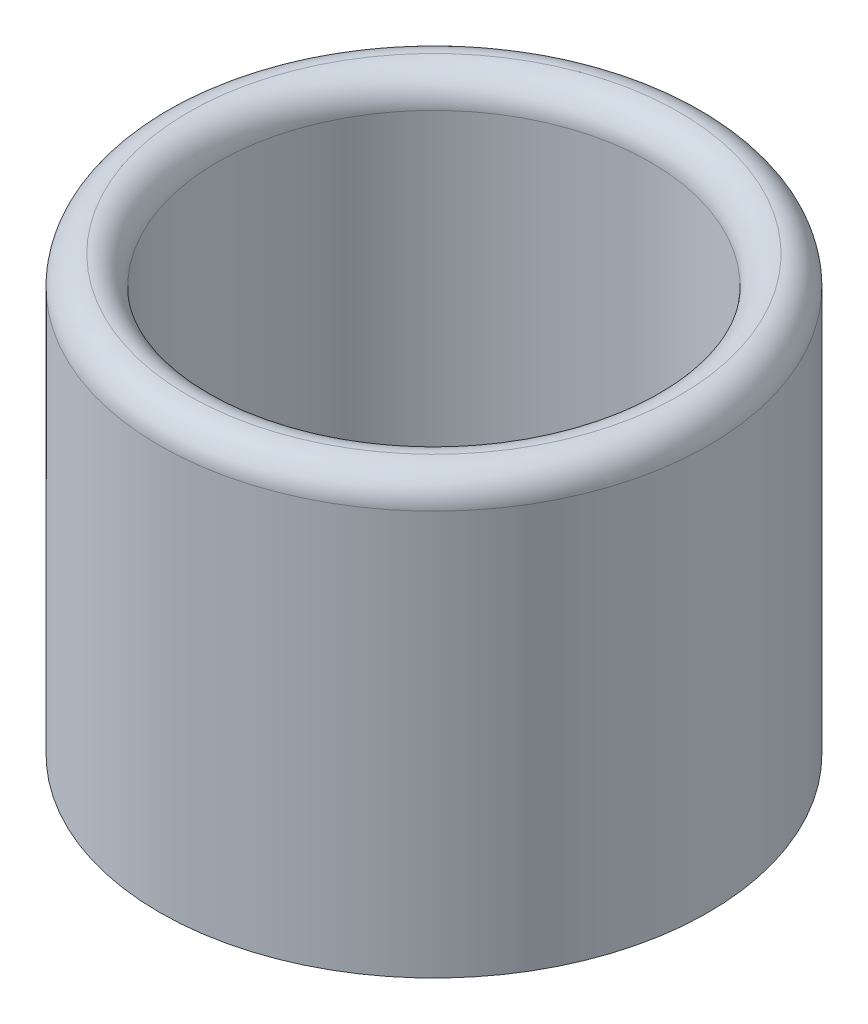
from build123d import *

# Parameters (mm, degrees)
SKETCH_1_R      = 3.8
SKETCH_1_R_2    = 3
EXTRUDE_1_DEPTH = 6
SKETCH_1_13_R   = 3
SKETCH_1_13_R_2 = 1.5
EXTRUDE_2_DEPTH = 0.8
FILLET_1_R      = 0.4


with BuildPart() as part:
    # 草图1 → 凸台-拉伸1 (new body)
    with BuildSketch(Plane(origin=(0, 0, 0), x_dir=(1, 0, 0), z_dir=(0, 1, 0))):
        with Locations(Location((-1.835e-06, 48.853027267, 0), (0, 0, 270))):
            Circle(SKETCH_1_R)
        with Locations(Location((-1.835e-06, 48.853027267, 0), (0, 0, 270))):
            Circle(SKETCH_1_R_2, mode=Mode.SUBTRACT)
    extrude(amount=EXTRUDE_1_DEPTH)

    # 草图1<13> → 凸台-拉伸2 (add)
    with BuildSketch(Plane(origin=(0, 0, 0), x_dir=(1, 0, 0), z_dir=(0, 1, 0))):
        with Locations(Location((-1.835e-06, 48.853027267, 0), (0, 0, 270))):
            Circle(SKETCH_1_13_R)
        with Locations(Location((-1.835e-06, 48.853027267, 0), (0, 0, 270))):
            Circle(SKETCH_1_13_R_2, mode=Mode.SUBTRACT)
    extrude(amount=EXTRUDE_2_DEPTH)

    # 圆角1
    fillet_1_edges = [part.edges().sort_by_distance(p)[0] for p in [
        (-1.835e-06, 6, -52.653027267),
        (-1.835e-06, 6, -51.853027267),
    ]]
    fillet(fillet_1_edges, radius=FILLET_1_R - 0.0001)  # a hair under: the kernel refuses the full size


solid = part.part
